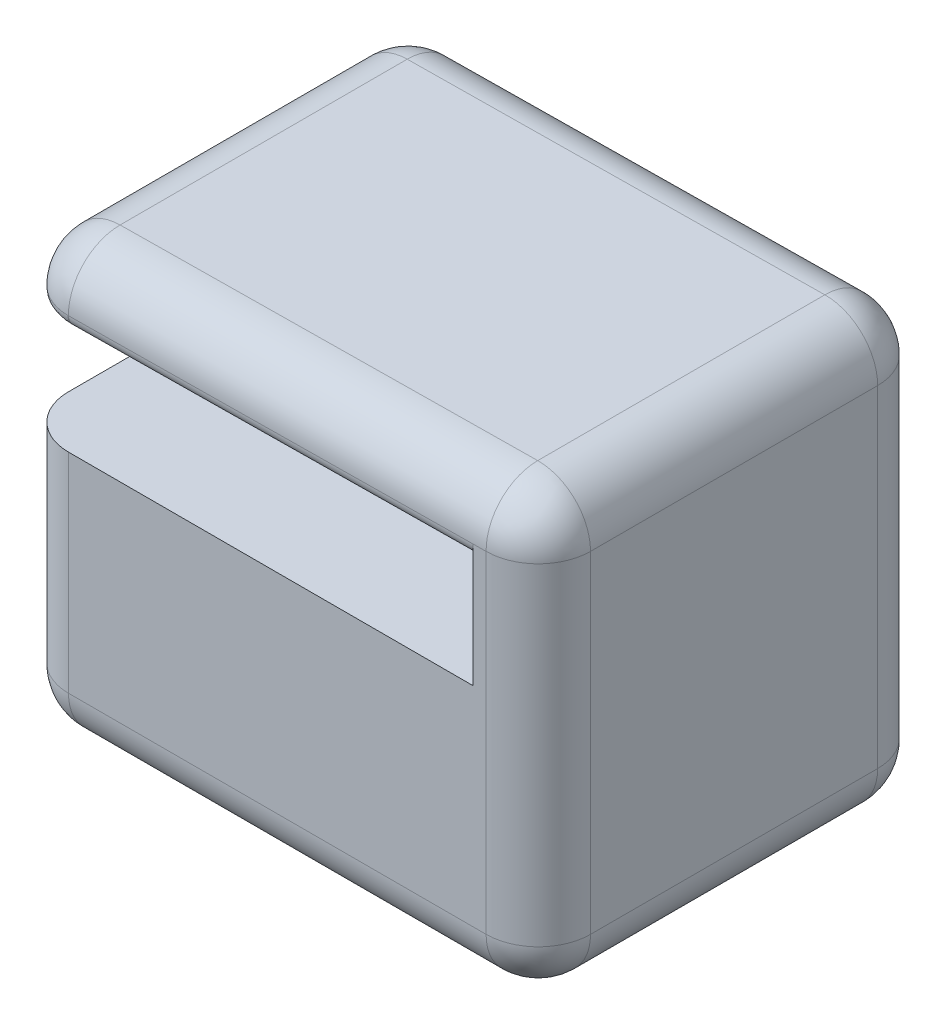
from build123d import *

# Parameters (mm, degrees)
BOSS_EXTRUDE1_DEPTH = 19.05
FILLET1_R           = 2.54
FILLET2_R           = 0.635


with BuildPart() as part:
    # Sketch1 → Boss-Extrude1 (new body)
    with BuildSketch(Plane.XY):
        Polygon((-25.398341139, -10.622644211), (0, -10.622644211), (0, 10.622644211), (-25.398341139, 10.332355789), (-25.398341139, 7.157355789), (-3.175, 7.411355789), (-3.175, 7.157355789), (-3.175, 2.077355789), (-25.398341139, 2.077355789), align=None)
    extrude(amount=BOSS_EXTRUDE1_DEPTH)

    # Fillet1
    fillet1_edges = [part.edges().sort_by_distance(p)[0] for p in [
        (-12.69917057, 10.4775, 0),
        (0, 0, 0),
        (-12.69917057, -10.622644211, 0),
        (-25.398341139, -4.272644211, 0),
        (-25.398341139, 10.332355789, 9.525),
        (0, 10.622644211, 9.525),
        (0, -10.622644211, 9.525),
        (-25.398341139, -10.622644211, 9.525),
        (-25.398341139, -4.272644211, 19.05),
        (-12.69917057, -10.622644211, 19.05),
        (0, 0, 19.05),
        (-12.69917057, 10.4775, 19.05),
        (-25.398341139, 8.744855789, 19.05),
        (-25.398341139, 8.744855789, 0),
    ]]
    fillet(fillet1_edges, radius=FILLET1_R)

    # Fillet2
    fillet2_edges = [part.edges().sort_by_distance(p)[0] for p in [
        (-13.01667057, 7.298871158, 0),
        (-25.398341139, 7.157355789, 9.525),
        (-24.654392364, 7.165858695, 18.306051224),
        (-24.654392364, 7.165858695, 0.743948776),
        (-13.01667057, 7.298871158, 19.05),
    ]]
    fillet(fillet2_edges, radius=FILLET2_R - 0.0004)  # a hair under: the kernel refuses the full size


solid = part.part
